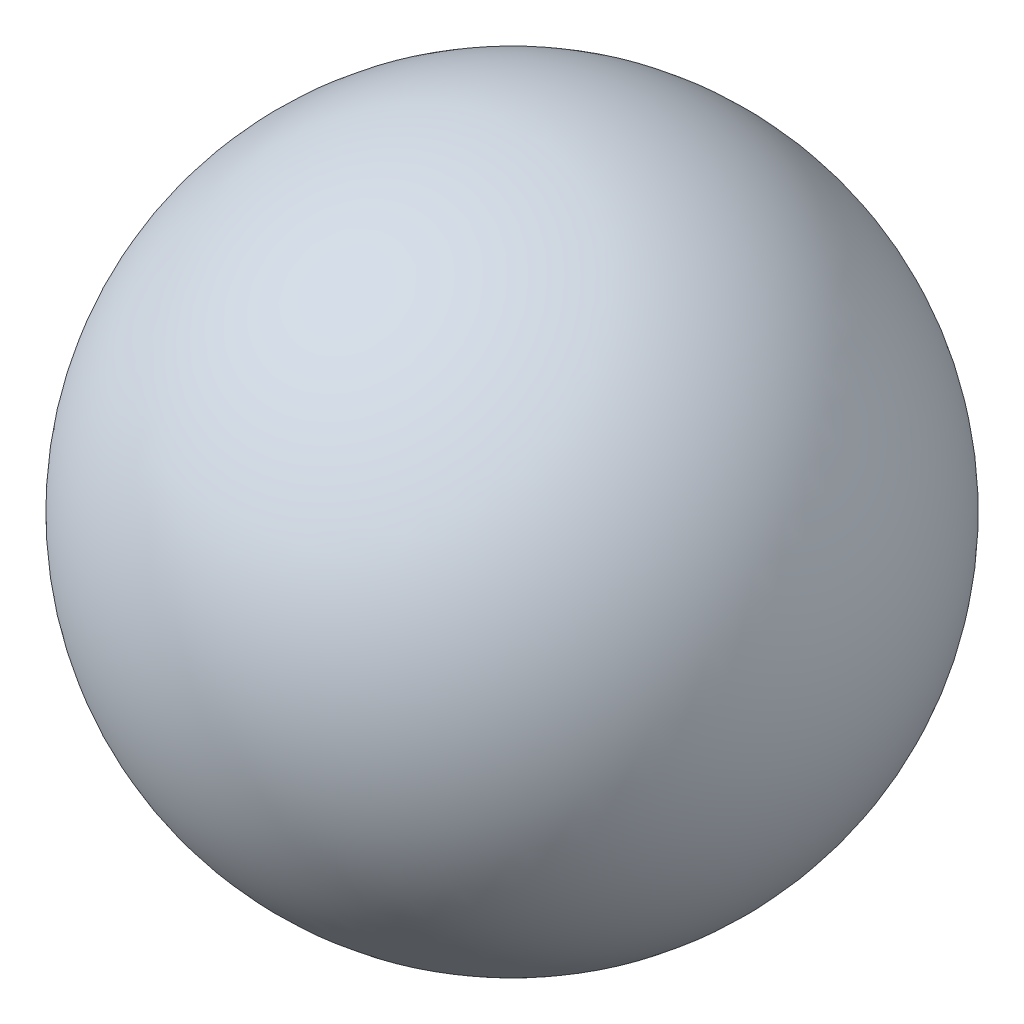
from build123d import *


with BuildPart() as part:
    # Sketch1 → Revolve1 (revolve)
    with BuildSketch(Plane.XY):
        with BuildLine():
            Line((0, 11), (0, -11))
            ThreePointArc((0, -11), (-11, 0), (0, 11))
        make_face()
    revolve(axis=Axis((0, 11, 0), (0, -1, 0)))


solid = part.part
